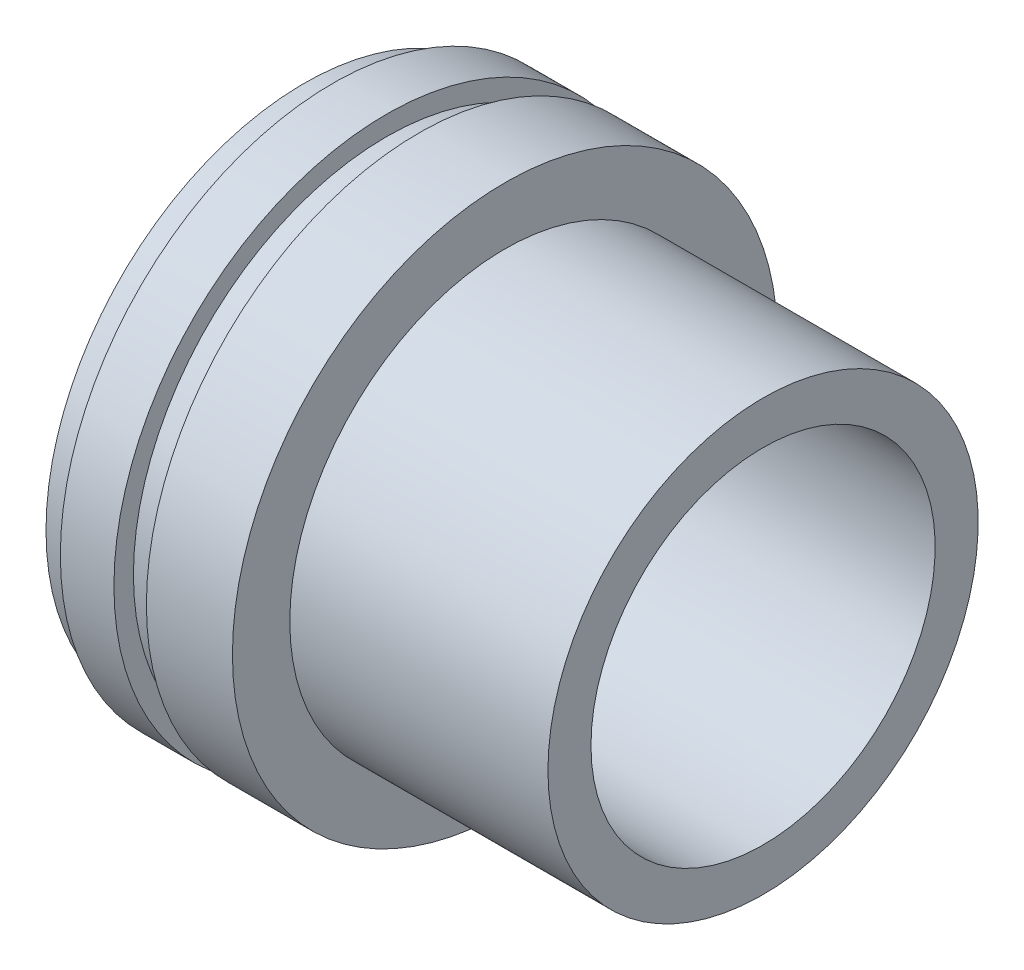
from build123d import *


with BuildPart() as part:
    # Sketch1 → Revolve1 (revolve)
    with BuildSketch(Plane.XY):
        Polygon((0, 9.525), (0, 3.175), (6.35, 3.175), (6.35, 0), (18.2118, 0), (18.2118, 4.318), (25.4, 4.318), (25.4, 0), (44.45, 0), (44.45, 12.7), (101.6, 12.7), (101.6, 22.225), (38.1, 22.225), (25.4, 9.525), align=None)
    revolve(axis=Axis((0, 60.325, 0), (1, 0, 0)))


solid = part.part
